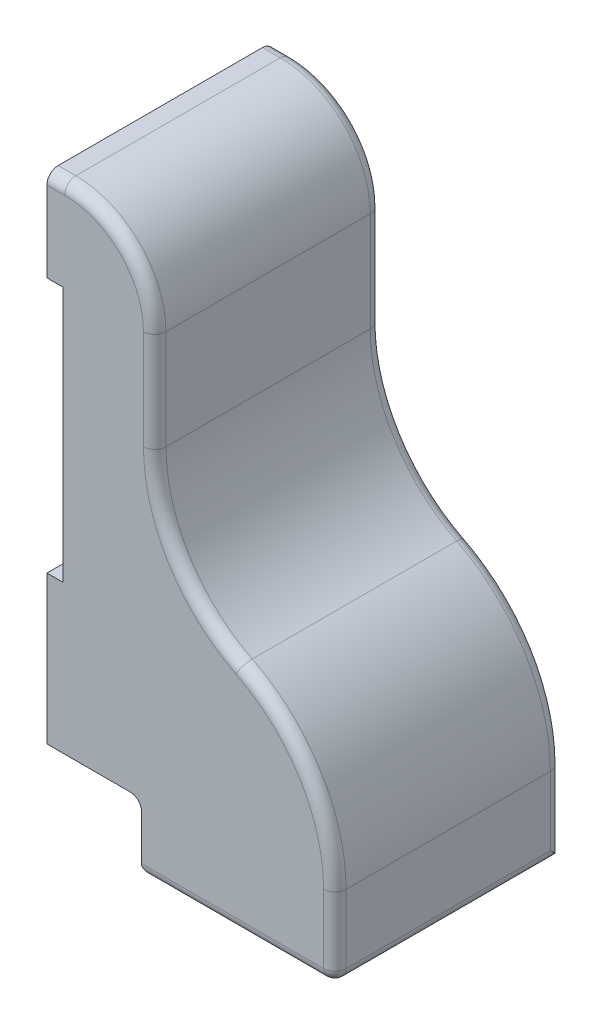
from build123d import *

# Parameters (mm, degrees)
SKETCH1_W           = 53.975
SKETCH1_H           = 31.75
BOSS_EXTRUDE1_DEPTH = 76.2
SHELL1_T            = 5
SKETCH2_W           = 44.45
SKETCH2_H           = 53.975
CUT_EXTRUDE1_DEPTH  = 5
FILLET2_R           = 6.35
SKETCH3_W           = 54.53
SKETCH3_H           = 63.975
SKETCH3_W_2         = 44.45
SKETCH3_H_2         = 53.975
BOSS_EXTRUDE2_DEPTH = 19.05
FILLET5_R           = 3.175
FILLET6_R           = 3.175
SKETCH4_W           = 53.975
SKETCH4_H           = 15.875
BOSS_EXTRUDE3_DEPTH = 25.4
SHELL2_T            = 5
SKETCH5_W           = 15.875
SKETCH5_H           = 53.975
CUT_EXTRUDE2_DEPTH  = 5
SKETCH6_W           = 25.875
SKETCH6_H           = 63.975
SKETCH6_W_2         = 15.875
SKETCH6_H_2         = 53.975
BOSS_EXTRUDE4_DEPTH = 72.0928
SKETCH7_W           = 15.875
SKETCH7_H           = 53.975
CUT_EXTRUDE3_DEPTH  = 5
FILLET7_R           = 44.45
FILLET8_R           = 46.99
FILLET9_R           = 46.99
FILLET10_R          = 48.26
FILLET11_R          = 6.35
FILLET12_R          = 6.35
FILLET13_R          = 19.05
FILLET14_R          = 25.4
FILLET15_R          = 3.175


with BuildPart() as part:
    # Sketch1 → Boss-Extrude1 (new body)
    with BuildSketch(Plane(origin=(0, 0, 0), x_dir=(0, 0, -1), z_dir=(1, 0, 0))):
        with Locations((106.854663617, 0)):
            Rectangle(SKETCH1_W, SKETCH1_H)
    extrude(amount=BOSS_EXTRUDE1_DEPTH)

    # Shell1
    shell1_openings = [part.faces().sort_by_distance(p)[0] for p in [
        (0, 0, -106.854663617),
    ]]
    offset(amount=SHELL1_T, openings=shell1_openings, kind=Kind.INTERSECTION)

    # Sketch2 → Cut-Extrude1 (cut)
    with BuildSketch(Plane(origin=(0, -20.875, 0), x_dir=(-1, 0, 0), z_dir=(0, -1, 0))):
        with Locations((-53.975, 106.854663617)):
            Rectangle(SKETCH2_W, SKETCH2_H)
    extrude(amount=-CUT_EXTRUDE1_DEPTH, mode=Mode.SUBTRACT)

    # Fillet2
    # the kernel refuses this fillet: 6.35 mm, written as the material it takes off along each edge
    with BuildSketch(Plane(origin=(31.75, -15.875, -79.867163617), x_dir=(-1, 0, 0), z_dir=(0, 0, -1))) as fillet2_piece_1:
        with BuildLine():
            CenterArc((6.204836823, -6.35), FILLET2_R, 90, 77.725329785)
            Line((0, -5), (0, 0))
            Line((0, 0), (6.204836823, 0))
        make_face()
    extrude(amount=53.975, mode=Mode.SUBTRACT)

    # Sketch3 → Boss-Extrude2 (add)
    with BuildSketch(Plane.XZ.offset(20.875)):
        with Locations((53.935, -106.854663617)):
            Rectangle(SKETCH3_W, SKETCH3_H)
        with Locations((53.975, -106.854663617)):
            Rectangle(SKETCH3_W_2, SKETCH3_H_2, mode=Mode.SUBTRACT)
    extrude(amount=BOSS_EXTRUDE2_DEPTH)

    # Fillet5
    fillet5_edges = [part.edges().sort_by_distance(p)[0] for p in [
        (26.67, -20.875, -106.854663617),
    ]]
    fillet(fillet5_edges, radius=FILLET5_R)

    # Fillet6
    fillet6_edges = [part.edges().sort_by_distance(p)[0] for p in [
        (26.67, -39.925, -106.854663617),
        (53.935, -39.925, -74.867163617),
    ]]
    fillet(fillet6_edges, radius=FILLET6_R)



with BuildPart() as body_2:
    # Sketch4 → Boss-Extrude3 (new body)
    with BuildSketch(Plane(origin=(0, 0, 0), x_dir=(0, 0, -1), z_dir=(1, 0, 0))):
        with Locations((106.854663617, 105.9053)):
            Rectangle(SKETCH4_W, SKETCH4_H)
    extrude(amount=BOSS_EXTRUDE3_DEPTH)

    # Shell2
    shell2_openings = [body_2.faces().sort_by_distance(p)[0] for p in [
        (0, 105.9053, -106.854663617),
    ]]
    offset(amount=SHELL2_T, openings=shell2_openings, kind=Kind.INTERSECTION)

    # Sketch5 → Cut-Extrude2 (cut)
    with BuildSketch(Plane.XZ.offset(-92.9678)):
        with Locations((17.4625, -106.854663617)):
            Rectangle(SKETCH5_W, SKETCH5_H)
    extrude(amount=-CUT_EXTRUDE2_DEPTH, mode=Mode.SUBTRACT)


with BuildPart() as part_1:
    add(part.part)

    add(body_2.part)  # Boss-Extrude4 merges body 2
    # Sketch6 → Boss-Extrude4 (add)
    with BuildSketch(Plane.XZ.offset(-92.9678)):
        with Locations((17.4625, -106.854663617)):
            Rectangle(SKETCH6_W, SKETCH6_H)
        with Locations((17.4625, -106.854663617)):
            Rectangle(SKETCH6_W_2, SKETCH6_H_2, mode=Mode.SUBTRACT)
    extrude(amount=BOSS_EXTRUDE4_DEPTH)

    # Sketch7 → Cut-Extrude3 (cut)
    with BuildSketch(Plane.XZ.offset(-15.875)):
        with Locations((17.4625, -106.854663617)):
            Rectangle(SKETCH7_W, SKETCH7_H)
    extrude(amount=-CUT_EXTRUDE3_DEPTH, mode=Mode.SUBTRACT)

    # Fillet7
    fillet7_edges = [part_1.edges().sort_by_distance(p)[0] for p in [
        (30.4, 20.875, -106.854663617),
    ]]
    fillet(fillet7_edges, radius=FILLET7_R)

    # Fillet8
    fillet8_edges = [part_1.edges().sort_by_distance(p)[0] for p in [
        (25.4, 15.875, -106.854663617),
    ]]
    fillet(fillet8_edges, radius=FILLET8_R)

    # Fillet9
    fillet9_edges = [part_1.edges().sort_by_distance(p)[0] for p in [
        (76.2, 15.875, -106.854663617),
    ]]
    fillet(fillet9_edges, radius=FILLET9_R)

    # Fillet10
    fillet10_edges = [part_1.edges().sort_by_distance(p)[0] for p in [
        (81.2, 20.875, -106.854663617),
    ]]
    fillet(fillet10_edges, radius=FILLET10_R)

    # Fillet11
    fillet11_edges = [part_1.edges().sort_by_distance(p)[0] for p in [
        (9.525, 15.875, -106.854663617),
    ]]
    fillet(fillet11_edges, radius=FILLET11_R)

    # Fillet12
    fillet12_edges = [part_1.edges().sort_by_distance(p)[0] for p in [
        (9.525, 97.9678, -106.854663617),
    ]]
    fillet(fillet12_edges, radius=FILLET12_R)

    # Fillet13
    fillet13_edges = [part_1.edges().sort_by_distance(p)[0] for p in [
        (25.4, 113.8428, -106.854663617),
    ]]
    fillet(fillet13_edges, radius=FILLET13_R)

    # Fillet14
    fillet14_edges = [part_1.edges().sort_by_distance(p)[0] for p in [
        (30.4, 118.8428, -106.854663617),
    ]]
    fillet(fillet14_edges, radius=FILLET14_R)

    # Fillet15
    fillet15_edges = [part_1.edges().sort_by_distance(p)[0] for p in [
        (81.2, -28.648204314, -138.842163617),
        (30.4, 79.3839, -74.867163617),
        (30.4, 79.3839, -138.842163617),
        (36.975381235, 42.058806641, -138.842163617),
        (36.975381235, 42.058806641, -74.867163617),
        (74.061014659, 7.889029876, -138.842163617),
        (74.061014659, 7.889029876, -74.867163617),
        (2.5, 118.8428, -74.867163617),
        (2.5, 118.8428, -138.842163617),
        (22.960512242, 111.403312242, -138.842163617),
        (22.960512242, 111.403312242, -74.867163617),
        (81.2, -39.925, -108.442163617),
        (81.2, -27.060704314, -74.867163617),
        (81.2, -38.99506403, -75.797099587),
    ]]
    fillet(fillet15_edges, radius=FILLET15_R)


solid = part_1.part
